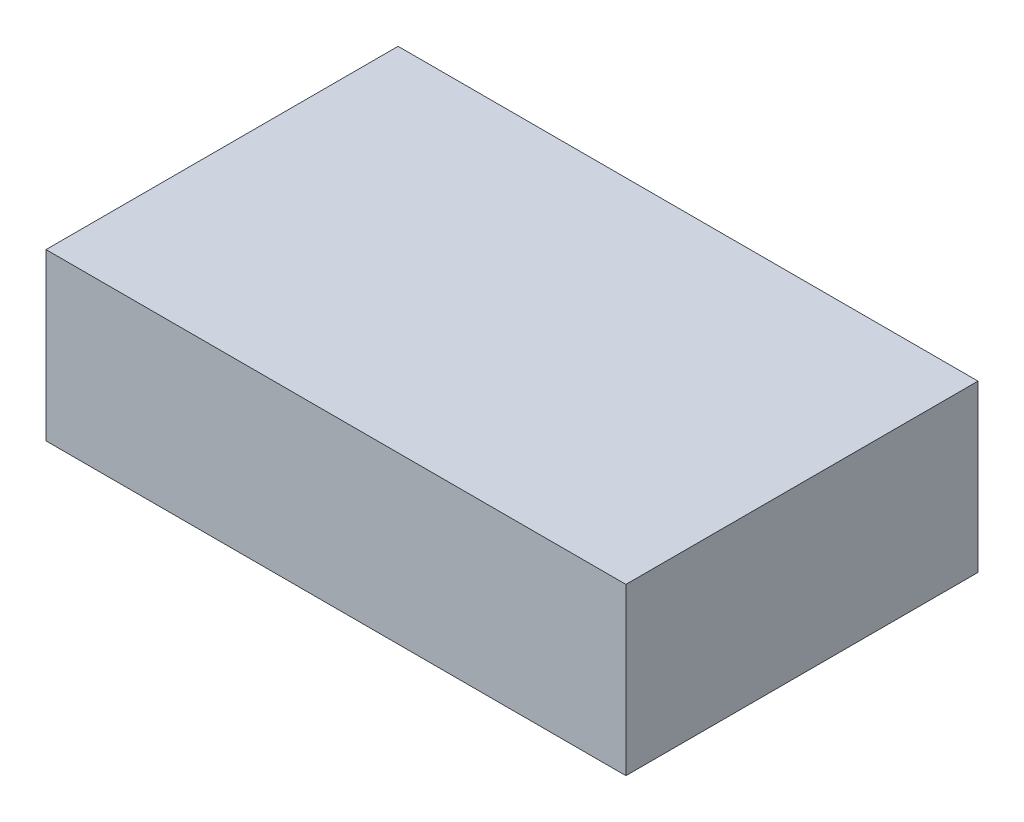
from build123d import *

# Parameters (mm, degrees)
SKETCH1_W           = 355.6
SKETCH1_H           = 215.9
BOSS_EXTRUDE1_DEPTH = 101.6


with BuildPart() as part:
    # Sketch1 → Boss-Extrude1 (new body)
    with BuildSketch(Plane(origin=(0, 0, 0), x_dir=(1, 0, 0), z_dir=(0, 1, 0))):
        with Locations((177.8, 107.95)):
            Rectangle(SKETCH1_W, SKETCH1_H)
    extrude(amount=BOSS_EXTRUDE1_DEPTH)


solid = part.part
